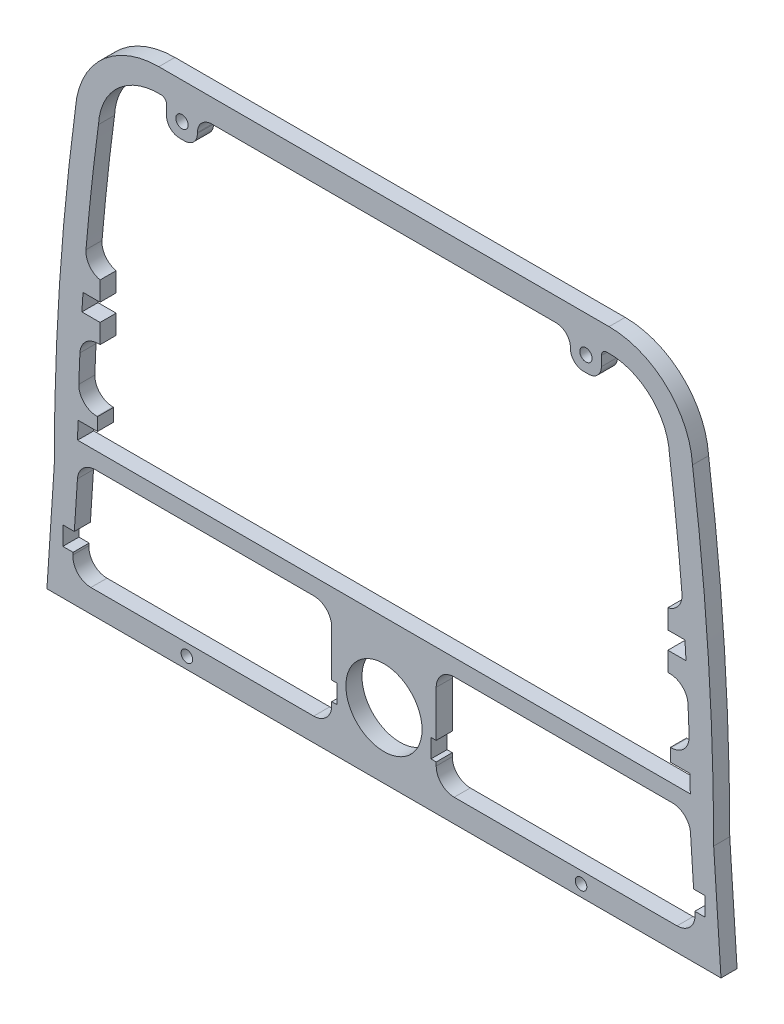
from build123d import *

# Parameters (mm, degrees)
SKETCH1_R           = 3.7592
SKETCH1_R_2         = 0.5715
SKETCH1_R_3         = 0.6096
BOSS_EXTRUDE1_DEPTH = 1.5875
FILLET1_R           = 1.778


with BuildPart() as part:
    # Sketch1 → Boss-Extrude1 (new body)
    with BuildSketch(Plane.XY):
        with BuildLine():
            Line((32.550881113, -11.307538914), (33.274, -22.225))
            Line((33.274, -22.225), (-33.274, -22.225))
            Line((-33.274, -22.225), (-32.550881113, -11.307538914))
            ThreePointArc((-32.550881113, -11.307538914), (-32.028077235, 4.496070358), (-30.461951667, 20.230575137))
            ThreePointArc((-30.461951667, 20.230575137), (-27.865979624, 25.711970539), (-22.225, 27.94))
            Line((-22.225, 27.94), (22.225, 27.94))
            ThreePointArc((22.225, 27.94), (27.865979624, 25.711970539), (30.461951667, 20.230575137))
            ThreePointArc((30.461951667, 20.230575137), (32.028077235, 4.496070358), (32.550881113, -11.307538914))
        make_face()
        with Locations((0, -15.748)):
            Circle(SKETCH1_R, mode=Mode.SUBTRACT)
        with Locations((19.457528855, -21.082)):
            Circle(SKETCH1_R_2, mode=Mode.SUBTRACT)
        with Locations((-19.939, 24.384)):
            Circle(SKETCH1_R_3, mode=Mode.SUBTRACT)
        with Locations((19.939, 24.384)):
            Circle(SKETCH1_R_3, mode=Mode.SUBTRACT)
        with Locations((-19.457528855, -21.082)):
            Circle(SKETCH1_R_2, mode=Mode.SUBTRACT)
        with BuildLine():
            Line((16.982329273, 25.654), (-16.982329273, 25.654))
            ThreePointArc((-16.982329273, 25.654), (-17.995380459, 25.234380459), (-18.415, 24.221329273))
            Line((-18.415, 24.221329273), (-18.415, 24.13))
            ThreePointArc((-18.415, 24.13), (-18.786974388, 23.231974388), (-19.685, 22.86))
            Line((-19.685, 22.86), (-20.193, 22.86))
            ThreePointArc((-20.193, 22.86), (-21.091025612, 23.231974388), (-21.463, 24.13))
            Line((-21.463, 24.13), (-21.463, 25.09062388))
            ThreePointArc((-21.463, 25.09062388), (-21.619564426, 25.478838601), (-22.001648865, 25.649819802))
            ThreePointArc((-22.001648865, 25.649819802), (-26.24741448, 24.095118224), (-28.185149732, 20.00992487))
            ThreePointArc((-28.185149732, 20.00992487), (-28.97064802, 13.418275107), (-29.571097928, 6.8072))
            Line((-29.571097928, 6.8072), (-28.02566998, 6.8072))
            Line((-28.02566998, 6.8072), (-28.02566998, 4.9022))
            Line((-28.02566998, 4.9022), (-29.709508346, 4.9022))
            ThreePointArc((-29.709508346, 4.9022), (-29.767162744, 4.038702455), (-29.821661459, 3.175))
            Line((-29.821661459, 3.175), (-28.02566998, 3.175))
            Line((-28.02566998, 3.175), (-28.02566998, 1.27))
            Line((-28.02566998, 1.27), (-29.93066998, 1.27))
            ThreePointArc((-29.93066998, 1.27), (-30.076613863, -1.86607048), (-30.180974457, -5.0038))
            Line((-30.180974457, -5.0038), (-28.275974457, -5.0038))
            Line((-28.275974457, -5.0038), (-28.275974457, -6.2738))
            Line((-28.275974457, -6.2738), (-30.211381152, -6.2738))
            ThreePointArc((-30.211381152, -6.2738), (-30.228164423, -7.137372267), (-30.241798154, -8.001))
            Line((-30.241798154, -8.001), (30.241798154, -8.001))
            ThreePointArc((30.241798154, -8.001), (30.228164423, -7.137372267), (30.211381152, -6.2738))
            Line((30.211381152, -6.2738), (28.275974457, -6.2738))
            Line((28.275974457, -6.2738), (28.275974457, -5.0038))
            Line((28.275974457, -5.0038), (30.180974457, -5.0038))
            ThreePointArc((30.180974457, -5.0038), (30.076613863, -1.86607048), (29.93066998, 1.27))
            Line((29.93066998, 1.27), (28.02566998, 1.27))
            Line((28.02566998, 1.27), (28.02566998, 3.175))
            Line((28.02566998, 3.175), (29.821661459, 3.175))
            ThreePointArc((29.821661459, 3.175), (29.767162744, 4.038702455), (29.709508346, 4.9022))
            Line((29.709508346, 4.9022), (28.02566998, 4.9022))
            Line((28.02566998, 4.9022), (28.02566998, 6.8072))
            Line((28.02566998, 6.8072), (29.571097928, 6.8072))
            ThreePointArc((29.571097928, 6.8072), (28.97064802, 13.418275107), (28.185149732, 20.00992487))
            ThreePointArc((28.185149732, 20.00992487), (26.24741448, 24.095118224), (22.001648865, 25.649819802))
            ThreePointArc((22.001648865, 25.649819802), (21.619564426, 25.478838601), (21.463, 25.09062388))
            Line((21.463, 25.09062388), (21.463, 24.13))
            ThreePointArc((21.463, 24.13), (21.091025612, 23.231974388), (20.193, 22.86))
            Line((20.193, 22.86), (19.685, 22.86))
            ThreePointArc((19.685, 22.86), (18.786974388, 23.231974388), (18.415, 24.13))
            Line((18.415, 24.13), (18.415, 24.221329273))
            ThreePointArc((18.415, 24.221329273), (17.995380459, 25.234380459), (16.982329273, 25.654))
        make_face(mode=Mode.SUBTRACT)
        Polygon((30.150217413, -9.652), (30.568707194, -15.97025), (30.330164629, -15.97025), (31.704083289, -15.97025), (31.704083289, -17.81175), (30.690679091, -17.81175), (30.83157766, -19.939), (19.965528855, -19.939), (18.949528855, -19.939), (5.1562, -19.939), (5.1562, -17.81175), (4.640078489, -17.81175), (4.640078489, -15.97025), (5.1562, -15.97025), (5.1562, -9.652), align=None, mode=Mode.SUBTRACT)
        Polygon((-30.83157766, -19.939), (-19.965528855, -19.939), (-18.949528855, -19.939), (-5.1562, -19.939), (-5.1562, -17.81175), (-4.640078489, -17.81175), (-4.640078489, -15.97025), (-5.1562, -15.97025), (-5.1562, -9.652), (-30.150217413, -9.652), (-30.568707194, -15.97025), (-31.704083289, -15.97025), (-31.704083289, -17.81175), (-30.690679091, -17.81175), align=None, mode=Mode.SUBTRACT)
    extrude(amount=BOSS_EXTRUDE1_DEPTH)

    # Fillet1
    # the kernel refuses this fillet: 1.778 mm, written as the material it adds along each edge
    with BuildSketch(Plane(origin=(-30.180974457, -5.0038, 0), x_dir=(1, 0, 0), z_dir=(0, 0, 1))) as fillet1_piece_1:
        with BuildLine():
            CenterArc((1.833067409, 1.778), FILLET1_R, 178.029670908, 91.970329092)
            Line((0.056118624, 1.839131111), (0.020579648, 1.840353734))
            ThreePointArc((0.020579648, 1.840353734), (-0.009270189, 0.920704615), (-0.035547402, 0.000946483))
            Line((-0.035547402, 0.000946483), (0, -0.03556))
            Line((0, -0.03556), (1.833067409, -0.03556))
            Line((1.833067409, -0.03556), (1.833067409, 0))
        make_face()
    extrude(amount=1.5875)
    with BuildSketch(Plane(origin=(-29.93066998, 1.27, 0), x_dir=(-0.04952574354141493, -0.9987728474115973, 0), z_dir=(0, 0, 1))) as fillet1_piece_2:
        with BuildLine():
            CenterArc((1.692020161, 1.777988571), FILLET1_R, 182.838777382, 87.366662802)
            Line((-0.083797962, 1.689931798), (-0.119314324, 1.688170663))
            Line((-0.119314324, 1.688170663), (-0.035516362, -0.001761135))
            Line((-0.035516362, -0.001761135), (-0.000127504, -0.035559771))
            ThreePointArc((-0.000127504, -0.035559771), (0.849197679, -0.037082446), (1.698522862, -0.035559771))
            Line((1.698522862, -0.035559771), (1.698395358, 0))
        make_face()
    extrude(amount=1.5875)
    with BuildSketch(Plane(origin=(-29.571097928, 6.8072, 0), x_dir=(1, 0, 0), z_dir=(0, 0, 1))) as fillet1_piece_3:
        with BuildLine():
            CenterArc((1.924023206, 1.737224692), FILLET1_R, 175.155271265, 82.550426931)
            Line((0.152375588, 1.887387004), (0.116942636, 1.89039025))
            ThreePointArc((0.116942636, 1.89039025), (0.038856877, 0.946707362), (-0.035455831, 0.002719862))
            Line((-0.035455831, 0.002719862), (0, -0.03556))
            ThreePointArc((0, -0.03556), (0.772713974, -0.03556), (1.537856043, -0.034744494))
            Line((1.537856043, -0.034744494), (1.545427948, 0))
        make_face()
    extrude(amount=1.5875)
    with BuildSketch(Plane(origin=(29.93066998, 1.27, 0), x_dir=(0.04952574354144595, -0.9987728474115959, 0), z_dir=(0, 0, 1))) as fillet1_piece_4:
        with BuildLine():
            CenterArc((1.692020161, -1.777988571), FILLET1_R, 89.794559817, 87.366662802)
            Line((-0.083797962, -1.689931798), (-0.119314324, -1.688170663))
            Line((-0.119314324, -1.688170663), (-0.035516362, 0.001761135))
            Line((-0.035516362, 0.001761135), (-0.000127504, 0.035559771))
            ThreePointArc((-0.000127504, 0.035559771), (0.849197679, 0.037082446), (1.698522862, 0.035559771))
            Line((1.698522862, 0.035559771), (1.698395358, 0))
        make_face()
    extrude(amount=1.5875)
    with BuildSketch(Plane(origin=(29.571097928, 6.8072, 0), x_dir=(-0.08047179326546709, 0.9967568863512506, 0), z_dir=(0, 0, 1))) as fillet1_piece_5:
        with BuildLine():
            CenterArc((1.886420273, 1.777985793), FILLET1_R, 187.678616869, 82.550426931)
            Line((0.124363358, 1.540415949), (0.08912222, 1.535664552))
            ThreePointArc((0.08912222, 1.535664552), (0.026737004, 0.773069552), (-0.035444675, 0.002861577))
            Line((-0.035444675, 0.002861577), (-0.000142153, -0.035559716))
            ThreePointArc((-0.000142153, -0.035559716), (0.946763965, -0.037452379), (1.893670084, -0.035559716))
            Line((1.893670084, -0.035559716), (1.89352793, 0))
        make_face()
    extrude(amount=1.5875)
    with BuildSketch(Plane(origin=(30.180974457, -5.0038, 0), x_dir=(-0.03049946566100157, 0.9995347830838072, 0), z_dir=(0, 0, 1))) as fillet1_piece_6:
        with BuildLine():
            CenterArc((1.833080421, 1.777986585), FILLET1_R, 178.252238302, 91.970329092)
            Line((0.055907577, 1.832214635), (0.02036412, 1.833299196))
            Line((0.02036412, 1.833299196), (-0.035543457, 0.001084561))
            Line((-0.035543457, 0.001084561), (-0.000138134, -0.035559732))
            ThreePointArc((-0.000138134, -0.035559732), (0.919993552, -0.037346875), (1.840125238, -0.035559732))
            Line((1.840125238, -0.035559732), (1.839987105, 0))
        make_face()
    extrude(amount=1.5875)
    with BuildSketch(Plane(origin=(-30.150217413, -9.652, 0), x_dir=(-0.06609026487531962, -0.9978136483776467, 0), z_dir=(0, 0, 1))) as fillet1_piece_7:
        with BuildLine():
            CenterArc((FILLET1_R * 0.935956064184, FILLET1_R), FILLET1_R, 183.789455341, 86.210544659)
            Line((-FILLET1_R * 0.0618575841936, FILLET1_R * 0.933909735125), (-FILLET1_R * 0.0818138571611, FILLET1_R * 0.932587929827))
            Line((-FILLET1_R * 0.0818138571611, FILLET1_R * 0.932587929827), (-FILLET1_R * 0.0187191212837, -FILLET1_R * 0.02))
            Line((-FILLET1_R * 0.0187191212837, -FILLET1_R * 0.02), (FILLET1_R * 0.935956064184, -FILLET1_R * 0.02))
            Line((FILLET1_R * 0.935956064184, -FILLET1_R * 0.02), (FILLET1_R * 0.935956064184, 0))
        make_face()
    extrude(amount=1.5875)
    with BuildSketch(Plane(origin=(-5.1562, -9.652, 0), x_dir=(-1, 0, 0), z_dir=(0, 0, 1)), Plane(origin=(5.1562, -9.652, 0), x_dir=(0, -1, 0), z_dir=(0, 0, 1)), Plane(origin=(-5.1562, -19.939, 0), x_dir=(0, 1, 0), z_dir=(0, 0, 1)), Plane(origin=(5.1562, -19.939, 0), x_dir=(1, 0, 0), z_dir=(0, 0, 1))) as fillet1_piece_8:
        with BuildLine():
            CenterArc((FILLET1_R, FILLET1_R), FILLET1_R, 180, 90)
            Line((0, FILLET1_R), (-FILLET1_R * 0.02, FILLET1_R))
            Line((-FILLET1_R * 0.02, FILLET1_R), (-FILLET1_R * 0.02, -FILLET1_R * 0.02))
            Line((-FILLET1_R * 0.02, -FILLET1_R * 0.02), (FILLET1_R, -FILLET1_R * 0.02))
            Line((FILLET1_R, -FILLET1_R * 0.02), (FILLET1_R, 0))
        make_face()
    extrude(amount=1.5875)
    with BuildSketch(Plane(origin=(30.150217413, -9.652, 0), x_dir=(0.06609026487531962, -0.9978136483776467, 0), z_dir=(0, 0, 1))) as fillet1_piece_9:
        with BuildLine():
            CenterArc((FILLET1_R * 0.935956064184, -FILLET1_R), FILLET1_R, 90, 86.210544659)
            Line((-FILLET1_R * 0.0618575841936, -FILLET1_R * 0.933909735125), (-FILLET1_R * 0.0818138571611, -FILLET1_R * 0.932587929827))
            Line((-FILLET1_R * 0.0818138571611, -FILLET1_R * 0.932587929827), (-FILLET1_R * 0.0187191212837, FILLET1_R * 0.02))
            Line((-FILLET1_R * 0.0187191212837, FILLET1_R * 0.02), (FILLET1_R * 0.935956064184, FILLET1_R * 0.02))
            Line((FILLET1_R * 0.935956064184, FILLET1_R * 0.02), (FILLET1_R * 0.935956064184, 0))
        make_face()
    extrude(amount=1.5875)
    with BuildSketch(Plane(origin=(-30.83157766, -19.939, 0), x_dir=(0.06609026487531591, 0.9978136483776471, 0), z_dir=(0, 0, 1))) as fillet1_piece_10:
        with BuildLine():
            CenterArc((FILLET1_R * 1.06842622028, -FILLET1_R), FILLET1_R, 90, 93.789455341)
            Line((FILLET1_R * 0.0706125718977, -FILLET1_R * 1.06609026488), (FILLET1_R * 0.0506562989302, -FILLET1_R * 1.06741207017))
            Line((FILLET1_R * 0.0506562989302, -FILLET1_R * 1.06741207017), (-FILLET1_R * 0.0213685244055, FILLET1_R * 0.02))
            Line((-FILLET1_R * 0.0213685244055, FILLET1_R * 0.02), (FILLET1_R * 1.06842622028, FILLET1_R * 0.02))
            Line((FILLET1_R * 1.06842622028, FILLET1_R * 0.02), (FILLET1_R * 1.06842622028, 0))
        make_face()
    extrude(amount=1.5875)
    with BuildSketch(Plane(origin=(30.83157766, -19.939, 0), x_dir=(-0.06609026487531046, 0.9978136483776474, 0), z_dir=(0, 0, 1))) as fillet1_piece_11:
        with BuildLine():
            CenterArc((FILLET1_R * 1.06842622028, FILLET1_R), FILLET1_R, 176.210544659, 93.789455341)
            Line((FILLET1_R * 0.0706125718977, FILLET1_R * 1.06609026488), (FILLET1_R * 0.0506562989302, FILLET1_R * 1.06741207017))
            Line((FILLET1_R * 0.0506562989302, FILLET1_R * 1.06741207017), (-FILLET1_R * 0.0213685244055, -FILLET1_R * 0.02))
            Line((-FILLET1_R * 0.0213685244055, -FILLET1_R * 0.02), (FILLET1_R * 1.06842622028, -FILLET1_R * 0.02))
            Line((FILLET1_R * 1.06842622028, -FILLET1_R * 0.02), (FILLET1_R * 1.06842622028, 0))
        make_face()
    extrude(amount=1.5875)


solid = part.part
